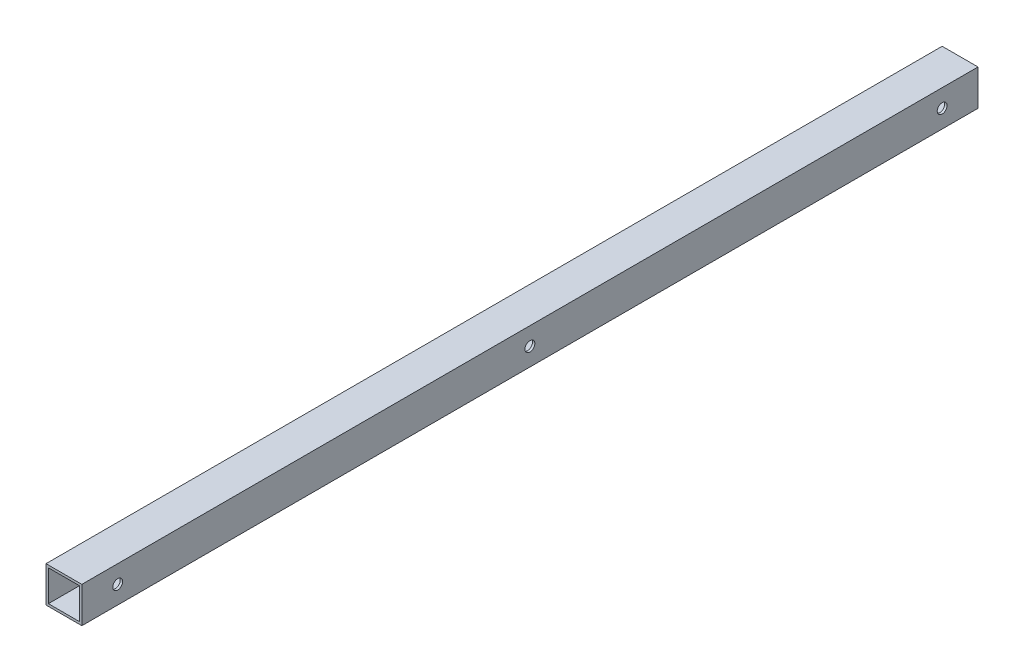
from build123d import *

# Parameters (mm, degrees)
SKETCH_1_W        = 30
SKETCH_1_H        = 30
SKETCH_1_W_2      = 26
SKETCH_1_H_2      = 26
EXTRUDE_1_DEPTH   = 750
HOLE_WIZARD_M81_D = 8.25


with BuildPart() as part:
    # Эскиз1 → Бобышка-Вытянуть1 (new body)
    with BuildSketch(Plane.XY):
        with Locations((15, 15)):
            Rectangle(SKETCH_1_W, SKETCH_1_H)
        with Locations((15, 15)):
            Rectangle(SKETCH_1_W_2, SKETCH_1_H_2, mode=Mode.SUBTRACT)
    extrude(amount=EXTRUDE_1_DEPTH)

    # Сверло под метчик  спиральное M81 (through all)
    with Locations(Plane(origin=(30, 0, 0), x_dir=(0, 0, -1), z_dir=(1, 0, 0))):
        with Locations((-720, 15), (-375, 15), (-30, 15)):
            Hole(HOLE_WIZARD_M81_D / 2)


solid = part.part
